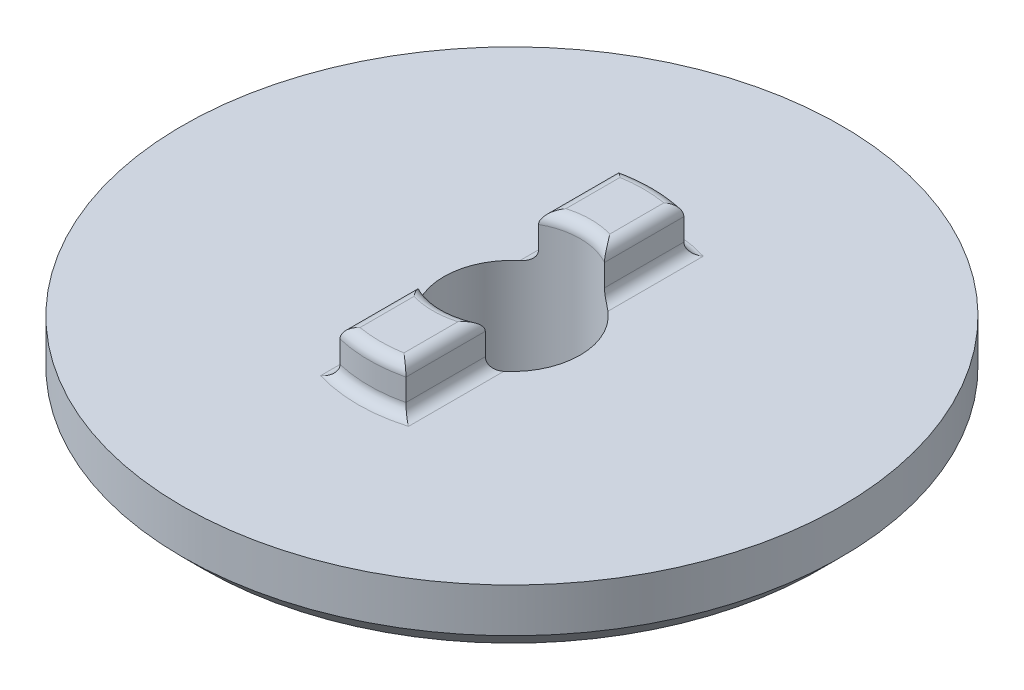
from build123d import *
from build123d.topology import SkipClean

# Parameters (mm, degrees)
SKETCH_1_R      = 15
SKETCH_1_R_2    = 3.1
EXTRUDE_1_DEPTH = 3
EXTRUDE_2_DEPTH = 2
FILLET_1_R      = 0.5
EXTRUDE_START   = 5
SKETCH_3_R      = 4.5
SKETCH_3_R_2    = 3.1
EXTRUDE_3_DEPTH = 5
FILLET_2_R      = 1.5
CHAMFER_1_SIZE  = 1


with BuildPart() as part:
    # Эскиз1 → Бобышка-Вытянуть1 (new body)
    with BuildSketch(Plane(origin=(0, 0, 0), x_dir=(1, 0, 0), z_dir=(0, 1, 0))):
        with Locations(Location((0, 0, 0), (0, 0, 270))):
            Circle(SKETCH_1_R)
        with Locations(Location((0, 0, 0), (0, 0, 270))):
            Circle(SKETCH_1_R_2, mode=Mode.SUBTRACT)
    extrude(amount=EXTRUDE_1_DEPTH)

    # Эскиз2 → Бобышка-Вытянуть2 (add)
    with SkipClean():  # the faces are left unmerged after this step: merging them gives an invalid solid
        with BuildSketch(Plane(origin=(0, 3, 0), x_dir=(1, 0, 0), z_dir=(0, 1, 0))):
            with BuildLine():
                ThreePointArc((1.5, 6.32455532), (0.755112713, 6.455989838), (0, 6.5))
                ThreePointArc((0, 6.5), (-0.755112713, 6.455989838), (-1.5, 6.32455532))
                Line((-1.5, 6.32455532), (-1.5, 2.712931993))
                ThreePointArc((-1.5, 2.712931993), (0, 3.1), (1.5, 2.712931993))
                Line((1.5, 2.712931993), (1.5, 6.32455532))
            make_face()
            with BuildLine():
                Line((-1.5, -2.712931993), (-1.5, -6.32455532))
                ThreePointArc((-1.5, -6.32455532), (-0.755112713, -6.455989838), (0, -6.5))
                ThreePointArc((0, -6.5), (0.755112713, -6.455989838), (1.5, -6.32455532))
                Line((1.5, -6.32455532), (1.5, -2.712931993))
                ThreePointArc((1.5, -2.712931993), (0, -3.1), (-1.5, -2.712931993))
            make_face()
        extrude(amount=EXTRUDE_2_DEPTH)

    # Скругление1
    # the kernel refuses this fillet: 0.5 mm, written as the material it adds along each edge
    with BuildSketch(Plane(origin=(0, 3, 0), x_dir=(0.4124871852399922, 0, -0.9109634032236357), z_dir=(0.9109634032236357, 0, 0.4124871852399922))) as fillet_1_piece_1_section:
        with BuildLine():
            CenterArc((6.5 + FILLET_1_R, FILLET_1_R), FILLET_1_R, 180, 90)
            Line((6.5, FILLET_1_R), (6.5, 0))
            Line((6.5, 0), (6.5 + FILLET_1_R, 0))
        make_face()
    fillet_1_piece_1 = revolve(axis=Axis((0, 3, 0), (0, 1, 0)), revolution_arc=48.722343885, mode=Mode.PRIVATE)
    fillet_1_piece_1 = split(fillet_1_piece_1, bisect_by=Plane(origin=(1.5, 3.113215634, -6.55559714), z_dir=(-1, 0, 0)), keep=Keep.TOP, mode=Mode.PRIVATE)
    fillet_1_piece_1 = split(fillet_1_piece_1, bisect_by=Plane(origin=(-1.5, 3.113215634, -6.55559714), z_dir=(1, 0, 0)), keep=Keep.TOP, mode=Mode.PRIVATE)
    add(fillet_1_piece_1)
    with BuildSketch(Plane(origin=(-1.5, 3, -7.57455532), x_dir=(-1, 0, 0), z_dir=(0, 0, 1))) as fillet_1_piece_2_section:
        with BuildLine():
            CenterArc((FILLET_1_R, -FILLET_1_R), FILLET_1_R, 90, 90)
            Line((0, -FILLET_1_R), (0, 0))
            Line((0, 0), (FILLET_1_R, 0))
        make_face()
    fillet_1_piece_2 = extrude(amount=6.111623327, mode=Mode.PRIVATE)
    fillet_1_piece_2 = fillet_1_piece_2 - Plane(origin=(0, 3.112507471, 0), x_dir=(0, 0, 1), z_dir=(0, -1, 0)) * Cylinder(3.1, 15, mode=Mode.PRIVATE)
    fillet_1_piece_2 = fillet_1_piece_2 & Plane(origin=(0, 3.112507471, 0), x_dir=(0.23076923076923161, 0, -0.9730085108210397), z_dir=(0, -1, 0)) * Cylinder(6.5, 15, mode=Mode.PRIVATE)
    add(fillet_1_piece_2)
    with BuildSketch(Plane(origin=(1.5, 3, -1.462931993), x_dir=(1, 0, 0), z_dir=(0, 0, -1))) as fillet_1_piece_3_section:
        with BuildLine():
            CenterArc((FILLET_1_R, -FILLET_1_R), FILLET_1_R, 90, 90)
            Line((0, -FILLET_1_R), (0, 0))
            Line((0, 0), (FILLET_1_R, 0))
        make_face()
    fillet_1_piece_3 = extrude(amount=6.111623327, mode=Mode.PRIVATE)
    fillet_1_piece_3 = fillet_1_piece_3 - Plane(origin=(0, 3.112507453, 0), x_dir=(0, 0, 1), z_dir=(0, -1, 0)) * Cylinder(3.1, 15, mode=Mode.PRIVATE)
    fillet_1_piece_3 = fillet_1_piece_3 & Plane(origin=(0, 3.112507453, 0), x_dir=(0.23076923076923161, 0, -0.9730085108210397), z_dir=(0, -1, 0)) * Cylinder(6.5, 15, mode=Mode.PRIVATE)
    add(fillet_1_piece_3)
    with BuildSketch(Plane(origin=(0, 3, 0), x_dir=(-0.41248718523999056, 0, 0.9109634032236364), z_dir=(-0.9109634032236364, 0, -0.41248718523999056))) as fillet_1_piece_4_section:
        with BuildLine():
            CenterArc((6.5 + FILLET_1_R, FILLET_1_R), FILLET_1_R, 180, 90)
            Line((6.5, FILLET_1_R), (6.5, 0))
            Line((6.5, 0), (6.5 + FILLET_1_R, 0))
        make_face()
    fillet_1_piece_4 = revolve(axis=Axis((0, 3, 0), (0, 1, 0)), revolution_arc=48.722343885, mode=Mode.PRIVATE)
    fillet_1_piece_4 = split(fillet_1_piece_4, bisect_by=Plane(origin=(-1.5, 3.113215634, 6.55559714), z_dir=(1, 0, 0)), keep=Keep.TOP, mode=Mode.PRIVATE)
    fillet_1_piece_4 = split(fillet_1_piece_4, bisect_by=Plane(origin=(1.5, 3.113215634, 6.55559714), z_dir=(-1, 0, 0)), keep=Keep.TOP, mode=Mode.PRIVATE)
    add(fillet_1_piece_4)
    with BuildSketch(Plane(origin=(-1.5, 3, 1.462931993), x_dir=(-1, 0, 0), z_dir=(0, 0, 1))) as fillet_1_piece_5_section:
        with BuildLine():
            CenterArc((FILLET_1_R, -FILLET_1_R), FILLET_1_R, 90, 90)
            Line((0, -FILLET_1_R), (0, 0))
            Line((0, 0), (FILLET_1_R, 0))
        make_face()
    fillet_1_piece_5 = extrude(amount=6.111623327, mode=Mode.PRIVATE)
    fillet_1_piece_5 = fillet_1_piece_5 - Plane(origin=(0, 3.112507486, 0), x_dir=(0, 0, 1), z_dir=(0, -1, 0)) * Cylinder(3.1, 15, mode=Mode.PRIVATE)
    fillet_1_piece_5 = fillet_1_piece_5 & Plane(origin=(0, 3.112507486, 0), x_dir=(-0.2307692307692237, 0, 0.9730085108210416), z_dir=(0, -1, 0)) * Cylinder(6.5, 15, mode=Mode.PRIVATE)
    add(fillet_1_piece_5)
    with BuildSketch(Plane(origin=(1.5, 3, 7.57455532), x_dir=(1, 0, 0), z_dir=(0, 0, -1))) as fillet_1_piece_6_section:
        with BuildLine():
            CenterArc((FILLET_1_R, -FILLET_1_R), FILLET_1_R, 90, 90)
            Line((0, -FILLET_1_R), (0, 0))
            Line((0, 0), (FILLET_1_R, 0))
        make_face()
    fillet_1_piece_6 = extrude(amount=6.111623327, mode=Mode.PRIVATE)
    fillet_1_piece_6 = fillet_1_piece_6 - Plane(origin=(0, 3.112507471, 0), x_dir=(0, 0, 1), z_dir=(0, -1, 0)) * Cylinder(3.1, 15, mode=Mode.PRIVATE)
    fillet_1_piece_6 = fillet_1_piece_6 & Plane(origin=(0, 3.112507471, 0), x_dir=(-0.2307692307692237, 0, 0.9730085108210416), z_dir=(0, -1, 0)) * Cylinder(6.5, 15, mode=Mode.PRIVATE)
    add(fillet_1_piece_6)
    with BuildSketch(Plane(origin=(1.5, 3, -1.462931993), x_dir=(1, 0, 0), z_dir=(0, 0, -1))) as fillet_1_piece_7a_section:
        with BuildLine():
            CenterArc((FILLET_1_R, -FILLET_1_R), FILLET_1_R, 90, 90)
            Line((0, -FILLET_1_R), (0, 0))
            Line((0, 0), (FILLET_1_R, 0))
        make_face()
    fillet_1_piece_7a = extrude(amount=6.111623327, mode=Mode.PRIVATE)
    fillet_1_piece_7a = fillet_1_piece_7a - Plane(origin=(0, 3.111790951, 0), x_dir=(0.23076923076923161, 0, -0.9730085108210397), z_dir=(0, -1, 0)) * Cylinder(6.5, 15, mode=Mode.PRIVATE)
    with BuildSketch(Plane(origin=(0, 3, 0), x_dir=(0.4124871852399922, 0, -0.9109634032236357), z_dir=(0.9109634032236357, 0, 0.4124871852399922))) as fillet_1_piece_7b_section:
        with BuildLine():
            CenterArc((6.5 + FILLET_1_R, FILLET_1_R), FILLET_1_R, 180, 90)
            Line((6.5, FILLET_1_R), (6.5, 0))
            Line((6.5, 0), (6.5 + FILLET_1_R, 0))
        make_face()
    fillet_1_piece_7b = revolve(axis=Axis((0, 3, 0), (0, 1, 0)), revolution_arc=48.722343885, mode=Mode.PRIVATE)
    fillet_1_piece_7b = split(fillet_1_piece_7b, bisect_by=Plane(origin=(1.5, 3.110928804, -6.256458374), z_dir=(1, 0, 0)), keep=Keep.TOP, mode=Mode.PRIVATE)
    fillet_1_piece_7 = fillet_1_piece_7a & fillet_1_piece_7b
    add(fillet_1_piece_7)
    with BuildSketch(Plane(origin=(0, 3, 0), x_dir=(0.4124871852399922, 0, -0.9109634032236357), z_dir=(0.9109634032236357, 0, 0.4124871852399922))) as fillet_1_piece_8a_section:
        with BuildLine():
            CenterArc((6.5 + FILLET_1_R, FILLET_1_R), FILLET_1_R, 180, 90)
            Line((6.5, FILLET_1_R), (6.5, 0))
            Line((6.5, 0), (6.5 + FILLET_1_R, 0))
        make_face()
    fillet_1_piece_8a = revolve(axis=Axis((0, 3, 0), (0, 1, 0)), revolution_arc=48.722343885, mode=Mode.PRIVATE)
    fillet_1_piece_8a = split(fillet_1_piece_8a, bisect_by=Plane(origin=(-1.5, 3.110928929, -6.256457803), z_dir=(-1, 0, 0)), keep=Keep.TOP, mode=Mode.PRIVATE)
    with BuildSketch(Plane(origin=(-1.5, 3, -7.57455532), x_dir=(-1, 0, 0), z_dir=(0, 0, 1))) as fillet_1_piece_8b_section:
        with BuildLine():
            CenterArc((FILLET_1_R, -FILLET_1_R), FILLET_1_R, 90, 90)
            Line((0, -FILLET_1_R), (0, 0))
            Line((0, 0), (FILLET_1_R, 0))
        make_face()
    fillet_1_piece_8b = extrude(amount=6.111623327, mode=Mode.PRIVATE)
    fillet_1_piece_8b = fillet_1_piece_8b - Plane(origin=(0, 3.11179098, 0), x_dir=(0.23076923076923161, 0, -0.9730085108210397), z_dir=(0, -1, 0)) * Cylinder(6.5, 15, mode=Mode.PRIVATE)
    fillet_1_piece_8 = fillet_1_piece_8a & fillet_1_piece_8b
    add(fillet_1_piece_8)
    with BuildSketch(Plane(origin=(-1.5, 3, 1.462931993), x_dir=(-1, 0, 0), z_dir=(0, 0, 1))) as fillet_1_piece_9a_section:
        with BuildLine():
            CenterArc((FILLET_1_R, -FILLET_1_R), FILLET_1_R, 90, 90)
            Line((0, -FILLET_1_R), (0, 0))
            Line((0, 0), (FILLET_1_R, 0))
        make_face()
    fillet_1_piece_9a = extrude(amount=6.111623327, mode=Mode.PRIVATE)
    fillet_1_piece_9a = fillet_1_piece_9a - Plane(origin=(0, 3.11179098, 0), x_dir=(-0.2307692307692237, 0, 0.9730085108210416), z_dir=(0, -1, 0)) * Cylinder(6.5, 15, mode=Mode.PRIVATE)
    with BuildSketch(Plane(origin=(0, 3, 0), x_dir=(-0.41248718523999056, 0, 0.9109634032236364), z_dir=(-0.9109634032236364, 0, -0.41248718523999056))) as fillet_1_piece_9b_section:
        with BuildLine():
            CenterArc((6.5 + FILLET_1_R, FILLET_1_R), FILLET_1_R, 180, 90)
            Line((6.5, FILLET_1_R), (6.5, 0))
            Line((6.5, 0), (6.5 + FILLET_1_R, 0))
        make_face()
    fillet_1_piece_9b = revolve(axis=Axis((0, 3, 0), (0, 1, 0)), revolution_arc=48.722343885, mode=Mode.PRIVATE)
    fillet_1_piece_9b = split(fillet_1_piece_9b, bisect_by=Plane(origin=(-1.5, 3.110928804, 6.256458374), z_dir=(-1, 0, 0)), keep=Keep.TOP, mode=Mode.PRIVATE)
    fillet_1_piece_9 = fillet_1_piece_9a & fillet_1_piece_9b
    add(fillet_1_piece_9)
    with BuildSketch(Plane(origin=(0, 3, 0), x_dir=(-0.41248718523999056, 0, 0.9109634032236364), z_dir=(-0.9109634032236364, 0, -0.41248718523999056))) as fillet_1_piece_10a_section:
        with BuildLine():
            CenterArc((6.5 + FILLET_1_R, FILLET_1_R), FILLET_1_R, 180, 90)
            Line((6.5, FILLET_1_R), (6.5, 0))
            Line((6.5, 0), (6.5 + FILLET_1_R, 0))
        make_face()
    fillet_1_piece_10a = revolve(axis=Axis((0, 3, 0), (0, 1, 0)), revolution_arc=48.722343885, mode=Mode.PRIVATE)
    fillet_1_piece_10a = split(fillet_1_piece_10a, bisect_by=Plane(origin=(1.5, 3.110928929, 6.256457803), z_dir=(1, 0, 0)), keep=Keep.TOP, mode=Mode.PRIVATE)
    with BuildSketch(Plane(origin=(1.5, 3, 7.57455532), x_dir=(1, 0, 0), z_dir=(0, 0, -1))) as fillet_1_piece_10b_section:
        with BuildLine():
            CenterArc((FILLET_1_R, -FILLET_1_R), FILLET_1_R, 90, 90)
            Line((0, -FILLET_1_R), (0, 0))
            Line((0, 0), (FILLET_1_R, 0))
        make_face()
    fillet_1_piece_10b = extrude(amount=6.111623327, mode=Mode.PRIVATE)
    fillet_1_piece_10b = fillet_1_piece_10b - Plane(origin=(0, 3.11179098, 0), x_dir=(-0.2307692307692237, 0, 0.9730085108210416), z_dir=(0, -1, 0)) * Cylinder(6.5, 15, mode=Mode.PRIVATE)
    fillet_1_piece_10 = fillet_1_piece_10a & fillet_1_piece_10b
    add(fillet_1_piece_10)
    # the kernel refuses this fillet: 0.5 mm, written as the material it takes off along each edge
    with BuildSketch(Plane(origin=(1.5, 5, -1.462931993), x_dir=(0, -1, 0), z_dir=(0, 0, -1)), Plane(origin=(-1.5, 5, -7.57455532), x_dir=(0, -1, 0), z_dir=(0, 0, 1)), Plane(origin=(1.5, 5, 7.57455532), x_dir=(0, -1, 0), z_dir=(0, 0, -1)), Plane(origin=(-1.5, 5, 1.462931993), x_dir=(0, -1, 0), z_dir=(0, 0, 1))) as fillet_1_2_piece_1:
        with BuildLine():
            CenterArc((FILLET_1_R, FILLET_1_R), FILLET_1_R, 180, 90)
            Line((0, FILLET_1_R), (0, 0))
            Line((0, 0), (FILLET_1_R, 0))
        make_face()
    extrude(amount=6.111623327, mode=Mode.SUBTRACT)
    with BuildSketch(Plane(origin=(0, 5, 0), x_dir=(-0.4124871852399967, 0, -0.9109634032236337), z_dir=(-0.9109634032236337, 0, 0.4124871852399967))) as fillet_1_2_piece_2:
        with BuildLine():
            CenterArc((6.5 - FILLET_1_R, FILLET_1_R), FILLET_1_R, 270, 90)
            Line((6.5 - FILLET_1_R, 0), (6.5, 0))
            Line((6.5, 0), (6.5, FILLET_1_R))
        make_face()
    revolve(axis=Axis((0, 5, 0), (0, -1, 0)), revolution_arc=48.722343885, mode=Mode.SUBTRACT)
    with BuildSketch(Plane(origin=(0, 5, 0), x_dir=(-0.7884994391105064, 0, -0.6150354741983723), z_dir=(-0.6150354741983723, 0, 0.7884994391105064))) as fillet_1_2_piece_3:
        with BuildLine():
            CenterArc((3.1 + FILLET_1_R, FILLET_1_R), FILLET_1_R, 180, 90)
            Line((3.1 + FILLET_1_R, 0), (3.1, 0))
            Line((3.1, 0), (3.1, FILLET_1_R))
        make_face()
    revolve(axis=Axis((0, 5, 0), (0, -1, 0)), revolution_arc=104.091004095, mode=Mode.SUBTRACT)
    with BuildSketch(Plane(origin=(0, 5, 0), x_dir=(0.4124871852399923, 0, 0.9109634032236357), z_dir=(0.9109634032236357, 0, -0.4124871852399923))) as fillet_1_2_piece_4:
        with BuildLine():
            CenterArc((6.5 - FILLET_1_R, FILLET_1_R), FILLET_1_R, 270, 90)
            Line((6.5 - FILLET_1_R, 0), (6.5, 0))
            Line((6.5, 0), (6.5, FILLET_1_R))
        make_face()
    revolve(axis=Axis((0, 5, 0), (0, -1, 0)), revolution_arc=48.722343885, mode=Mode.SUBTRACT)
    with BuildSketch(Plane(origin=(0, 5, 0), x_dir=(0.788499439110485, 0, 0.6150354741983998), z_dir=(0.6150354741983998, 0, -0.788499439110485))) as fillet_1_2_piece_5:
        with BuildLine():
            CenterArc((3.1 + FILLET_1_R, FILLET_1_R), FILLET_1_R, 180, 90)
            Line((3.1 + FILLET_1_R, 0), (3.1, 0))
            Line((3.1, 0), (3.1, FILLET_1_R))
        make_face()
    revolve(axis=Axis((0, 5, 0), (0, -1, 0)), revolution_arc=104.091004095, mode=Mode.SUBTRACT)

    # Эскиз3 → Бобышка-Вытянуть3 (add)
    with SkipClean():  # the faces are left unmerged after this step: merging them gives an invalid solid
        with BuildSketch(Plane.XZ.offset(EXTRUDE_START)):
            with Locations(Location((0, 0, 0), (0, 0, 90))):
                Circle(SKETCH_3_R)
            with Locations(Location((0, 0, 0), (0, 0, 270))):
                Circle(SKETCH_3_R_2, mode=Mode.SUBTRACT)
        extrude(amount=-EXTRUDE_3_DEPTH)
    add(part.part.scale(1), mode=Mode.REPLACE)  # the faces are merged on a copy

    # Скругление2
    fillet_2_edges = [part.edges().sort_by_distance(p)[0] for p in [
        (0, 0, -4.5),
    ]]
    fillet(fillet_2_edges, radius=FILLET_2_R)

    # Фаска1
    chamfer_1_edges = [part.edges().sort_by_distance(p)[0] for p in [
        (0, 0, -15),
    ]]
    chamfer(chamfer_1_edges, length=CHAMFER_1_SIZE)


solid = part.part
